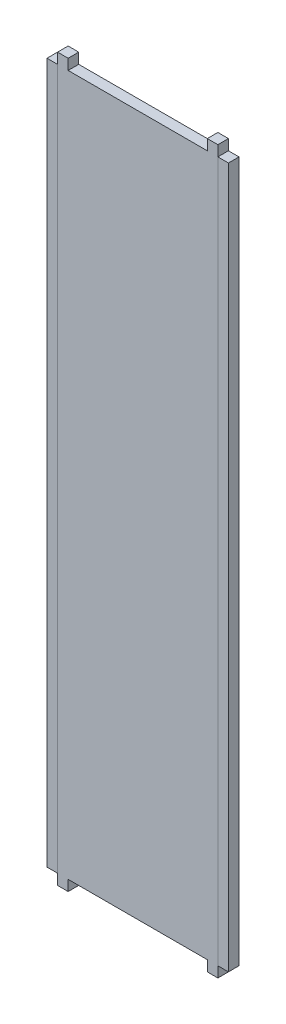
from build123d import *

# Parameters (mm, degrees)
SKETCH1_W             = 25
SKETCH1_H             = 112.55
BOSS_EXTRUDE1_DEPTH   = 1.65
SKETCH2_W             = 1.65
SKETCH2_H             = 109.25
BOSS_EXTRUDE2_DEPTH   = 1.65
BOSS_EXTRUDE2_2_DEPTH = 1.65
SKETCH3_W             = 21.7
SKETCH3_H             = 1.65
CUT_EXTRUDE1_DEPTH    = 1.65


with BuildPart() as part:
    # Sketch1 → Boss-Extrude1 (new body)
    with BuildSketch(Plane.XY):
        Rectangle(SKETCH1_W, SKETCH1_H)
    extrude(amount=BOSS_EXTRUDE1_DEPTH)

    # Sketch3 → Cut-Extrude1 (cut)
    with BuildSketch(Plane(origin=(0, 56.275, 0), x_dir=(1, 0, 0), z_dir=(0, 1, 0))):
        with Locations((0, -0.825)):
            Rectangle(SKETCH3_W, SKETCH3_H)
    cut_extrude1 = extrude(amount=-CUT_EXTRUDE1_DEPTH, mode=Mode.SUBTRACT)

    # Mirror1: Cut-Extrude1 across plane
    add(cut_extrude1.mirror(Plane.ZX), mode=Mode.SUBTRACT)


with BuildPart() as body_2:
    # Sketch2 → Boss-Extrude2 (new body)
    with BuildSketch(Plane.XY.offset(1.65)):
        with Locations((13.325, 0)):
            Rectangle(SKETCH2_W, SKETCH2_H)
    extrude(amount=-BOSS_EXTRUDE2_DEPTH)


with BuildPart() as body_3:
    # Sketch2 → Boss-Extrude2 2 (new body)
    with BuildSketch(Plane.XY.offset(1.65)):
        with Locations((-13.325, 0)):
            Rectangle(SKETCH2_W, SKETCH2_H)
    extrude(amount=-BOSS_EXTRUDE2_2_DEPTH)


solid = Compound([part.part, body_2.part, body_3.part])
